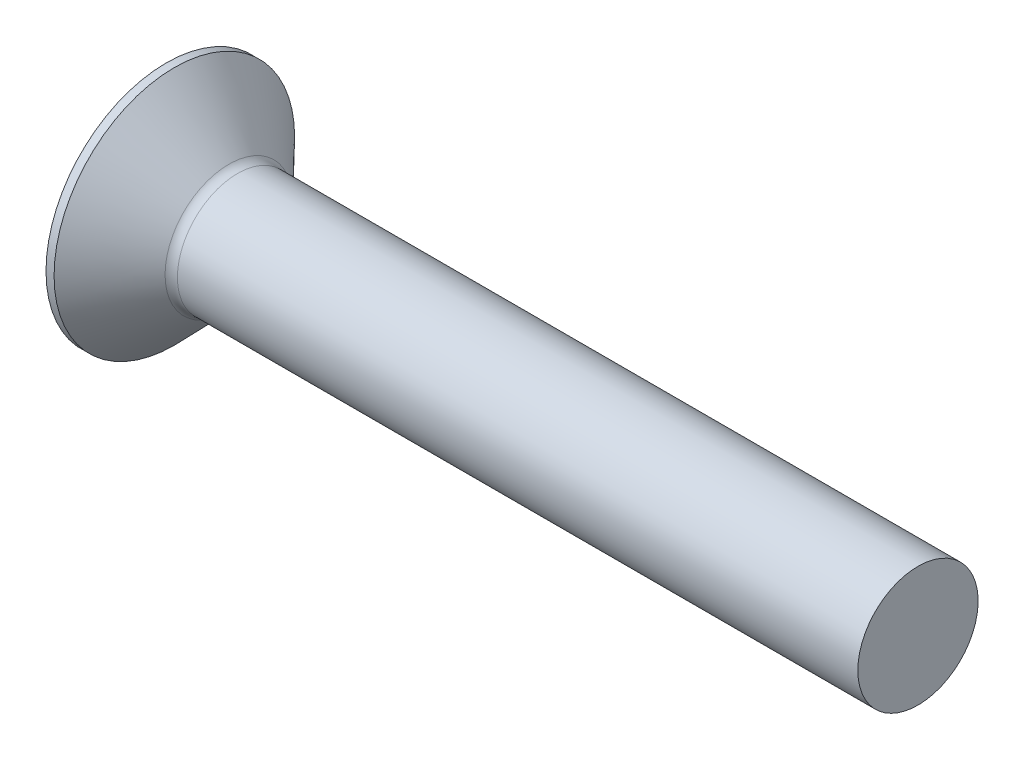
from build123d import *

# Parameters (mm, degrees)
FILLET1_R    = 0.8
RECPAT_COUNT = 2
RECPAT_ANGLE = 90


with BuildPart() as part:
    # BodySke → BaseBody (revolve)
    with BuildSketch(Plane.XY):
        Polygon((0, 0), (0, 8), (0.537244901, 8), (4.4, 4), (50, 4), (50, 0), align=None)
    revolve(axis=Axis((0, 0, 0), (1, 0, 0)))

    # Fillet1
    fillet1_edges = [part.edges().sort_by_distance(p)[0] for p in [
        (4.4, -4, 0),
    ]]
    fillet(fillet1_edges, radius=FILLET1_R)

    # RecSkeTop → Recess section 0
    with BuildSketch(Plane.ZY):
        with BuildLine():
            Line((-0.924, 4.2), (0.924, 4.2))
            Line((0.924, 4.2), (0.924, -4.2))
            Line((0.924, -4.2), (-0.924, -4.2))
            Line((-0.924, -4.2), (-0.924, 4.2))
        make_face()
    # RecSkeBot → Recess section 1
    with BuildSketch(Plane(origin=(4.96, 0, 0), x_dir=(0, 0, -1), z_dir=(1, 0, 0))):
        with BuildLine():
            Line((0.924, 1.727035638), (-0.924, 1.727035638))
            Line((-0.924, 1.727035638), (-0.924, -1.727035638))
            Line((-0.924, -1.727035638), (0.924, -1.727035638))
            Line((0.924, -1.727035638), (0.924, 1.727035638))
        make_face()
    recess = loft(mode=Mode.SUBTRACT)

    # RecPat: Recess ×2 about axis
    recpat_axis = Axis((0, 0, 0), (1, 0, 0))
    for i in range(1, RECPAT_COUNT):
        add(recess.rotate(recpat_axis, i * RECPAT_ANGLE / (RECPAT_COUNT - 1)), mode=Mode.SUBTRACT)

    # RecCorSke → RecessCore (revolve, cut)
    with BuildSketch(Plane.XY):
        Polygon((0, 0), (0, 2.0328), (4.96, 1.685963013), (5.50780259, 0), align=None)
    revolve(axis=Axis((0, 0, 0), (1, 0, 0)), mode=Mode.SUBTRACT)


solid = part.part
